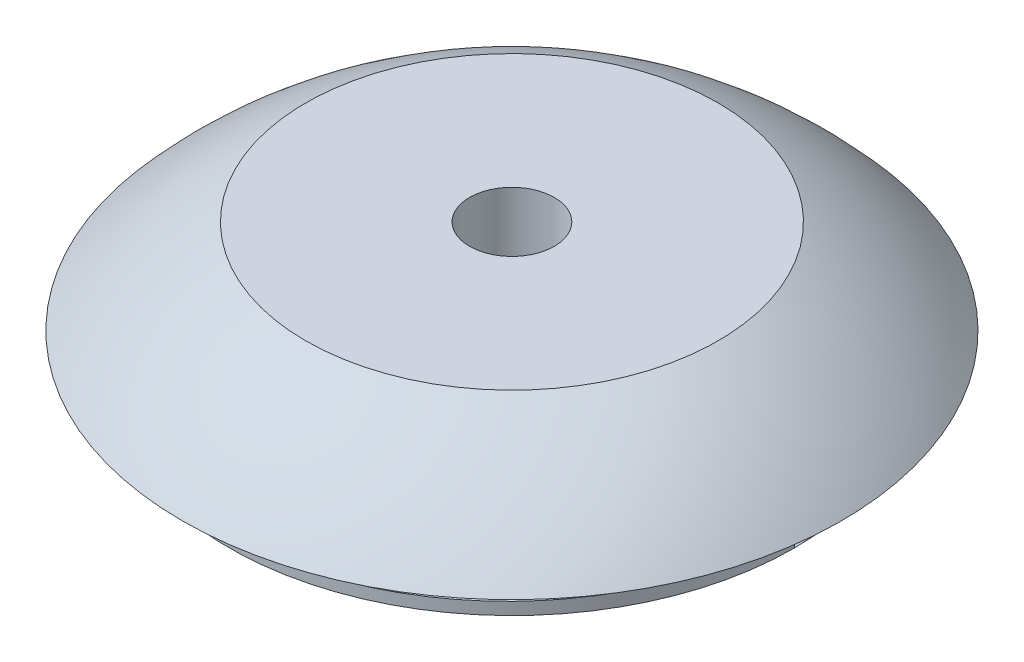
from build123d import *

# Parameters (mm, degrees)
SKETCH2_R           = 30
BOSS_EXTRUDE1_DEPTH = 5
THREAD1_PITCH       = 1.5
SKETCH3_R           = 4.5
CUT_EXTRUDE1_DEPTH  = 52.720402502


with BuildPart() as part:
    # Sketch1 → Revolve1 (revolve)
    with BuildSketch(Plane.XY):
        with BuildLine():
            Line((0, 0), (35, 0))
            ThreePointArc((35, 0), (19.171194527, 11.215855368), (0, 14.184322097))
            Line((0, 14.184322097), (0, 0))
        make_face()
    revolve(axis=Axis((0, 76.929088081, 0), (0, -1, 0)))

    # Sketch2 → Boss-Extrude1 (add)
    with BuildSketch(Plane.XZ):
        with Locations(Location((0, 0, 0), (0, 0, 90))):
            Circle(SKETCH2_R)
    extrude(amount=BOSS_EXTRUDE1_DEPTH)

    # Thread1: the profile of Thread Profile1 profile screwed along a right-hand helix of 3.333333 turns, 8 arcs to a turn; built about Z, then put on its axis
    thread1_z = Axis((0, 0, 0), (0, 0, 1))
    thread1_corners = [(30.0003, 0, -0.000173205), (30.0003, 0, 1.312673201), (29.188101187, 0, 0.843749998), (29.188101187, 0, 0.468749998)]
    with BuildLine(mode=Mode.PRIVATE) as thread1_profile:
        Line(thread1_corners[0], thread1_corners[1])
        Line(thread1_corners[1], thread1_corners[2])
        Line(thread1_corners[2], thread1_corners[3])
        Line(thread1_corners[3], thread1_corners[0])
    thread1_cap = Face(thread1_profile.wire())
    thread1_turn_angles = [0, 22.5, 45, 67.5, 90, 112.5, 135, 157.5, 180, 202.5, 225, 247.5, 270, 292.5, 315, 337.5, 360]
    thread1_turn_weights = [1, 0.9238795325112867, 1, 0.9238795325112867, 1, 0.9238795325112867, 1, 0.9238795325112867, 1, 0.9238795325112867, 1, 0.9238795325112867, 1, 0.9238795325112867, 1, 0.9238795325112867, 1]
    thread1_turn_rails = [Edge.make_bspline([Vector(p[0], p[1], 0).rotate(thread1_z, thread1_turn_angles[k]) / thread1_turn_weights[k] + Vector(0, 0, p[2] + THREAD1_PITCH * thread1_turn_angles[k] / 360) for k in range(17)], [0, 0, 0, 1, 1, 2, 2, 3, 3, 4, 4, 5, 5, 6, 6, 7, 7, 8, 8, 8], 2, thread1_turn_weights) for p in thread1_corners]
    thread1_turn_sides = [Face.make_surface_from_curves(thread1_turn_rails[p[0]], thread1_turn_rails[p[1]]) for p in [(0, 1), (1, 2), (2, 3), (3, 0)]]
    thread1_last_angles = [1080, 1102.5, 1125, 1147.5, 1170, 1185, 1200]
    thread1_last_weights = [1, 0.9238795325112867, 1, 0.9238795325112867, 1, 0.9659258262890688, 1]
    thread1_last_rails = [Edge.make_bspline([Vector(p[0], p[1], 0).rotate(thread1_z, thread1_last_angles[k]) / thread1_last_weights[k] + Vector(0, 0, p[2] + THREAD1_PITCH * thread1_last_angles[k] / 360) for k in range(7)], [0, 0, 0, 1, 1, 2, 2, 3, 3, 3], 2, thread1_last_weights) for p in thread1_corners]
    thread1_last_sides = [Face.make_surface_from_curves(thread1_last_rails[p[0]], thread1_last_rails[p[1]]) for p in [(0, 1), (1, 2), (2, 3), (3, 0)]]
    thread1 = Plane(origin=(0, -5, 0), x_dir=(1, 0, 0), z_dir=(0, 1, 0)) * Solid(Shell([*[p.moved(Location((0, 0, THREAD1_PITCH * i))) for i in range(3) for p in thread1_turn_sides], *thread1_last_sides, thread1_cap, thread1_cap.rotate(thread1_z, 1200).moved(Location((0, 0, THREAD1_PITCH * 1200 / 360)))]))
    add(thread1, mode=Mode.SUBTRACT)

    # SurfaceCut2
    split(bisect_by=Plane(origin=(0, 10, 0), x_dir=(1, 0, 0), z_dir=(0, 1, 0)), keep=Keep.BOTTOM)

    # Sketch3 → Cut-Extrude1 (cut, through all)
    with BuildSketch(Plane(origin=(0, 10, 0), x_dir=(1, 0, 0), z_dir=(0, 1, 0))):
        with Locations(Location((0, 0, 0), (0, 0, 270))):
            Circle(SKETCH3_R)
    extrude(amount=-CUT_EXTRUDE1_DEPTH, mode=Mode.SUBTRACT)


solid = part.part
